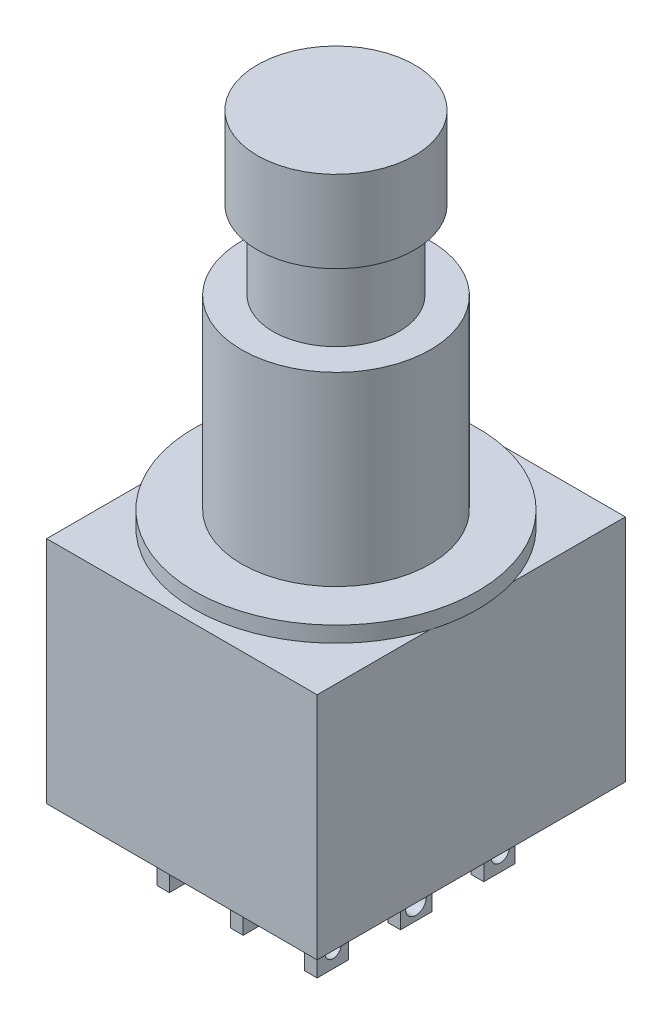
from build123d import *

# Parameters (mm, degrees)
SKETCH_1_W                       = 17.2
SKETCH_1_H                       = 19.6
EXTRUDE_1_DEPTH                  = 14.6
SKETCH_2_R                       = 9
EXTRUDE_2_DEPTH                  = 1
SKETCH_3_R                       = 6
EXTRUDE_3_DEPTH                  = 11.8
SKETCH_4_R                       = 4
EXTRUDE_4_DEPTH                  = 5
SKETCH_5_R                       = 5
EXTRUDE_5_DEPTH                  = 5.2
SKETCH_6_W                       = 0.8
SKETCH_6_H                       = 2
EXTRUDE_6_DEPTH                  = 4.5
PATTERN_LINEAR_1_COUNT           = 2
PATTERN_LINEAR_1_PITCH           = 5.3
PATTERN_LINEAR_2_COUNT           = 2
PATTERN_LINEAR_2_PITCH           = 4.7
PATTERN_LINEAR_2_COPY_1_SKETCH_W = 0.8
PATTERN_LINEAR_2_COPY_1_SKETCH_H = 2
PATTERN_LINEAR_2_COPY_1_DEPTH    = 4.5
PATTERN_LINEAR_3_COUNT           = 2
PATTERN_LINEAR_3_PITCH           = 5.3
PATTERN_LINEAR_3_COPY_1_SKETCH_W = 0.8
PATTERN_LINEAR_3_COPY_1_SKETCH_H = 2
PATTERN_LINEAR_3_COPY_1_DEPTH    = 4.5
PATTERN_LINEAR_3_COPY_2_SKETCH_W = 0.8
PATTERN_LINEAR_3_COPY_2_SKETCH_H = 2
PATTERN_LINEAR_3_COPY_2_DEPTH    = 4.5
PATTERN_LINEAR_3_COPY_3_SKETCH_W = 0.8
PATTERN_LINEAR_3_COPY_3_SKETCH_H = 2
PATTERN_LINEAR_3_COPY_3_DEPTH    = 4.5
PATTERN_START                    = -6.3
PATTERN_LINEAR_4_OUTLINE_W       = 0.8
PATTERN_LINEAR_4_OUTLINE_H       = 4.5
PATTERN_LINEAR_4_DEPTH           = 2
PATTERN_START_2                  = -1
PATTERN_LINEAR_4_2_OUTLINE_W     = 0.8
PATTERN_LINEAR_4_2_OUTLINE_H     = 4.5
PATTERN_LINEAR_4_2_DEPTH         = 2
PATTERN_START_3                  = 4.3
PATTERN_LINEAR_4_3_OUTLINE_W     = 0.8
PATTERN_LINEAR_4_3_OUTLINE_H     = 4.5
PATTERN_LINEAR_4_3_DEPTH         = 2
CUT_EXTRUDE_1_DEPTH              = 42.335335973


# Read off the part's stored shape, not the designer's step: 阵列(线性)4
with BuildPart() as part:
    # 草图1 → 凸台-拉伸1 (new body)
    with BuildSketch(Plane(origin=(0, 0, 0), x_dir=(1, 0, 0), z_dir=(0, 1, 0))):
        Rectangle(SKETCH_1_W, SKETCH_1_H)
    extrude(amount=EXTRUDE_1_DEPTH)

    # 草图2 → 凸台-拉伸2 (add)
    with BuildSketch(Plane(origin=(0, 14.6, 0), x_dir=(1, 0, 0), z_dir=(0, 1, 0))):
        with Locations(Location((0, 0, 0), (0, 0, 17.146209999))):
            Circle(SKETCH_2_R)
    extrude(amount=EXTRUDE_2_DEPTH)

    # 草图3 → 凸台-拉伸3 (add)
    with BuildSketch(Plane(origin=(0, 15.6, 0), x_dir=(1, 0, 0), z_dir=(0, 1, 0))):
        with Locations(Location((0, 0, 0), (0, 0, 270))):
            Circle(SKETCH_3_R)
    extrude(amount=EXTRUDE_3_DEPTH)

    # 草图4 → 凸台-拉伸4 (add)
    with BuildSketch(Plane(origin=(0, 27.4, 0), x_dir=(1, 0, 0), z_dir=(0, 1, 0))):
        with Locations(Location((0, 0, 0), (0, 0, 270))):
            Circle(SKETCH_4_R)
    extrude(amount=EXTRUDE_4_DEPTH)

    # 草图5 → 凸台-拉伸5 (add)
    with BuildSketch(Plane(origin=(0, 32.4, 0), x_dir=(1, 0, 0), z_dir=(0, 1, 0))):
        with Locations(Location((0, 0, 0), (0, 0, 270))):
            Circle(SKETCH_5_R)
    extrude(amount=EXTRUDE_5_DEPTH)

    # 草图6 → 凸台-拉伸6 (add)
    with BuildSketch(Plane.XZ):
        Rectangle(SKETCH_6_W, SKETCH_6_H)
    extrude_6 = extrude(amount=EXTRUDE_6_DEPTH)

    # 阵列(线性)1: 凸台-拉伸6 ×2
    with Locations(*[(0, 0, i * PATTERN_LINEAR_1_PITCH) for i in range(1, PATTERN_LINEAR_1_COUNT)]):
        add(extrude_6)

    # 阵列(线性)2: 凸台-拉伸6 ×2
    with Locations(*[(-i * PATTERN_LINEAR_2_PITCH, 0, 0) for i in range(1, PATTERN_LINEAR_2_COUNT)]):
        add(extrude_6)

    # 阵列(线性)2 copy 1 sketch → 阵列(线性)2 copy 1 (add)
    with BuildSketch(Plane(origin=(-4.7, 0, 5.3), x_dir=(1, 0, 0), z_dir=(0, -1, 0))):
        Rectangle(PATTERN_LINEAR_2_COPY_1_SKETCH_W, PATTERN_LINEAR_2_COPY_1_SKETCH_H)
    extrude(amount=PATTERN_LINEAR_2_COPY_1_DEPTH)

    # 阵列(线性)3: 凸台-拉伸6 ×2
    with Locations(*[(0, 0, -i * PATTERN_LINEAR_3_PITCH) for i in range(1, PATTERN_LINEAR_3_COUNT)]):
        add(extrude_6)

    # 阵列(线性)3 copy 1 sketch → 阵列(线性)3 copy 1 (add)
    with BuildSketch(Plane.XZ):
        Rectangle(PATTERN_LINEAR_3_COPY_1_SKETCH_W, PATTERN_LINEAR_3_COPY_1_SKETCH_H)
    extrude(amount=PATTERN_LINEAR_3_COPY_1_DEPTH)

    # 阵列(线性)3 copy 2 sketch → 阵列(线性)3 copy 2 (add)
    with BuildSketch(Plane(origin=(-4.7, 0, -5.3), x_dir=(1, 0, 0), z_dir=(0, -1, 0))):
        Rectangle(PATTERN_LINEAR_3_COPY_2_SKETCH_W, PATTERN_LINEAR_3_COPY_2_SKETCH_H)
    extrude(amount=PATTERN_LINEAR_3_COPY_2_DEPTH)

    # 阵列(线性)3 copy 3 sketch → 阵列(线性)3 copy 3 (add)
    with BuildSketch(Plane(origin=(-4.7, 0, 0), x_dir=(1, 0, 0), z_dir=(0, -1, 0))):
        Rectangle(PATTERN_LINEAR_3_COPY_3_SKETCH_W, PATTERN_LINEAR_3_COPY_3_SKETCH_H)
    extrude(amount=PATTERN_LINEAR_3_COPY_3_DEPTH)

    # 阵列(线性)4 outline → 阵列(线性)4 (add)
    with BuildSketch(Plane.XY.offset(PATTERN_START)):
        with Locations((4.7, -2.25)):
            Rectangle(PATTERN_LINEAR_4_OUTLINE_W, PATTERN_LINEAR_4_OUTLINE_H)
    extrude(amount=PATTERN_LINEAR_4_DEPTH)

    # Pattern Linear 4 2 outline → Pattern Linear 4 2 (add)
    with BuildSketch(Plane.XY.offset(PATTERN_START_2)):
        with Locations((4.7, -2.25)):
            Rectangle(PATTERN_LINEAR_4_2_OUTLINE_W, PATTERN_LINEAR_4_2_OUTLINE_H)
    extrude(amount=PATTERN_LINEAR_4_2_DEPTH)

    # Pattern Linear 4 3 outline → Pattern Linear 4 3 (add)
    with BuildSketch(Plane.XY.offset(PATTERN_START_3)):
        with Locations((4.7, -2.25)):
            Rectangle(PATTERN_LINEAR_4_3_OUTLINE_W, PATTERN_LINEAR_4_3_OUTLINE_H)
    extrude(amount=PATTERN_LINEAR_4_3_DEPTH)

    # 草图7 → 切除-拉伸1 (cut, through all)
    with BuildSketch(Plane.ZY.offset(5.1)):
        with BuildLine():
            Line((-0.642660902, -3.529284683), (-0.642660902, -1.428383643))
            ThreePointArc((-0.642660902, -1.428383643), (0.015637107, -0.770085634), (0.673935116, -1.428383643))
            Line((0.673935116, -1.428383643), (0.673935116, -3.529284683))
            ThreePointArc((0.673935116, -3.529284683), (0.015637107, -4.187582692), (-0.642660902, -3.529284683))
        make_face()
        with BuildLine():
            Line((-5.929653449, -3.387727592), (-5.841132285, -1.107614892))
            ThreePointArc((-5.841132285, -1.107614892), (-5.239978984, -0.551394487), (-4.683758579, -1.152547788))
            Line((-4.683758579, -1.152547788), (-4.772279743, -3.432660488))
            ThreePointArc((-4.772279743, -3.432660488), (-5.373433044, -3.988880894), (-5.929653449, -3.387727592))
        make_face()
        with BuildLine():
            Line((4.773595849, -3.425492164), (4.773595849, -1.220322784))
            ThreePointArc((4.773595849, -1.220322784), (5.285264786, -0.708653848), (5.796933722, -1.220322784))
            Line((5.796933722, -1.220322784), (5.796933722, -3.425492164))
            ThreePointArc((5.796933722, -3.425492164), (5.285264786, -3.937161101), (4.773595849, -3.425492164))
        make_face()
    extrude(amount=-CUT_EXTRUDE_1_DEPTH, mode=Mode.SUBTRACT)


solid = part.part
